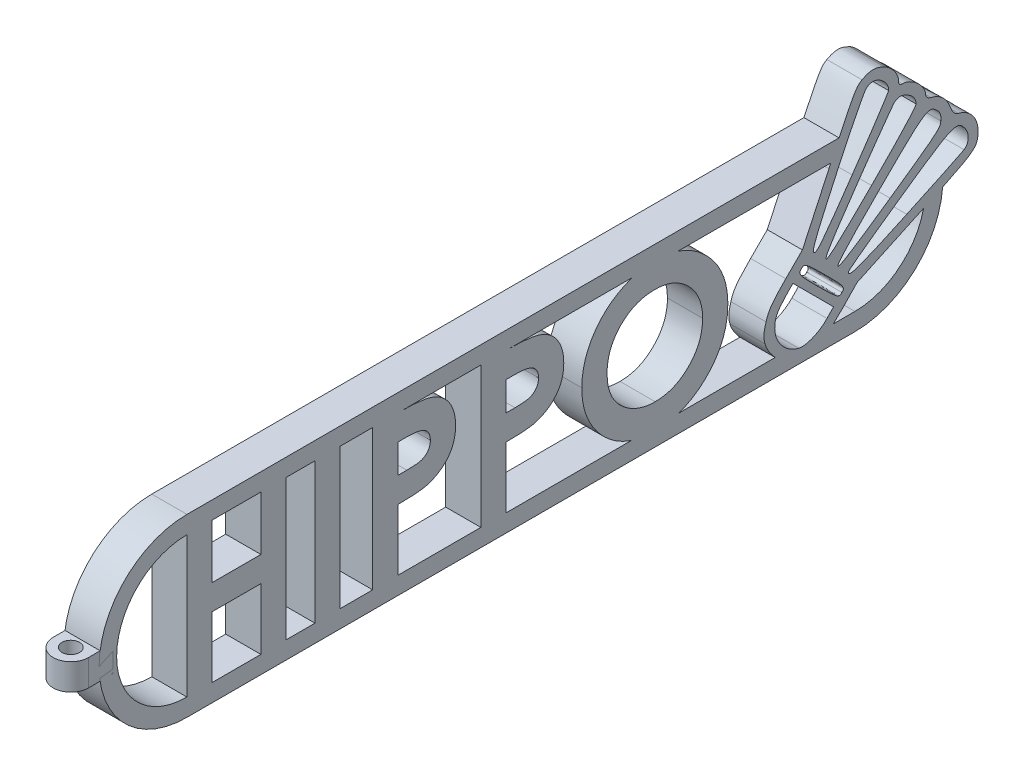
from build123d import *

# Parameters (mm, degrees)
BOSS_EXTRUDE1_DEPTH   = 3
SKETCH1_W             = 2.871794872
SKETCH1_H             = 16
BOSS_EXTRUDE1_2_DEPTH = 3
BOSS_EXTRUDE1_3_DEPTH = 3
BOSS_EXTRUDE1_4_DEPTH = 3
BOSS_EXTRUDE1_5_DEPTH = 3
BOSS_EXTRUDE2_DEPTH   = 3
BOSS_EXTRUDE4_START   = 1
SKETCH4_W             = 5.538461538
SKETCH4_H             = 6.974358974
SKETCH4_H_2           = 6.153846154
SKETCH4_W_2           = 3.282051282
SKETCH4_H_3           = 16
SKETCH4_W_3           = 3.692307692
BOSS_EXTRUDE4_DEPTH   = 1
SKETCH3_R             = 1
BOSS_EXTRUDE3_DEPTH   = 1.5


with BuildPart() as part:
    # Sketch1 → Boss-Extrude1 (new body)
    with BuildSketch(Plane(origin=(0, 0, 0), x_dir=(0, 0, -1), z_dir=(1, 0, 0))):
        Polygon((1.846153846, 16), (4.717948718, 16), (4.717948718, 9.846153846), (10.256410256, 9.846153846), (10.256410256, 16), (13.128205128, 16), (13.128205128, 0), (10.256410256, 0), (10.256410256, 6.974358974), (4.717948718, 6.974358974), (4.717948718, 0), (1.846153846, 0), align=None)
    extrude(amount=BOSS_EXTRUDE1_DEPTH)



with BuildPart() as body_2:
    # Sketch1 → Boss-Extrude1 2 (new body)
    with BuildSketch(Plane(origin=(0, 0, 0), x_dir=(0, 0, -1), z_dir=(1, 0, 0))):
        with Locations((17.846153846, 8)):
            Rectangle(SKETCH1_W, SKETCH1_H)
    extrude(amount=BOSS_EXTRUDE1_2_DEPTH)


with BuildPart() as body_3:
    # Sketch1 → Boss-Extrude1 3 (new body)
    with BuildSketch(Plane(origin=(0, 0, 0), x_dir=(0, 0, -1), z_dir=(1, 0, 0))):
        with BuildLine():
            Line((22.974358974, 16), (26.179487179, 16))
            add(Edge.make_bspline(
                [(26.179487179, 16), (26.388906098, 15.999062596), (26.79291909, 15.997254148), (27.375539064, 15.975324309), (27.913034516, 15.936024701), (28.405281958, 15.887456601), (28.85207899, 15.819366014), (29.253985136, 15.741305488), (29.611083801, 15.646205047), (29.927401804, 15.533322142), (30.211286994, 15.400237608), (30.479933945, 15.25849308), (30.727271206, 15.089325984), (30.965782637, 14.910968432), (31.181832127, 14.706381996), (31.388898137, 14.4891822), (31.578210856, 14.250755079), (31.75064749, 13.993986728), (31.907074088, 13.723621129), (32.043738828, 13.439174949), (32.154593612, 13.14019808), (32.247586992, 12.828624565), (32.32228018, 12.50446798), (32.371998344, 12.165734736), (32.405769422, 11.814789995), (32.408749254, 11.575936784), (32.41025641, 11.455128205)],
                knots=[0, 0, 0, 0, 1.698747864, 3.27724071, 4.728299578, 6.070144658, 7.288476769, 8.393259625, 9.389771311, 10.283485332, 11.113357557, 11.931608583, 12.74405601, 13.541433047, 14.344816069, 15.154114104, 15.974336324, 16.810834471, 17.661136416, 18.50621059, 19.367396281, 20.244825668, 21.142564693, 22.063065223, 23.020325768, 24, 24, 24, 24], degree=3))
            add(Edge.make_bspline(
                [(32.41025641, 11.455128205), (32.408075743, 11.321480551), (32.403790465, 11.058846488), (32.361780928, 10.673857173), (32.290015365, 10.306804718), (32.196221528, 9.954593703), (32.065432693, 9.62301878), (31.916012591, 9.304168471), (31.732178471, 9.006982358), (31.522118599, 8.727743002), (31.292709255, 8.464180055), (31.03850427, 8.223903399), (30.764348901, 8.005275075), (30.471830135, 7.806003843), (30.159849768, 7.626491675), (29.82863291, 7.465057633), (29.475917825, 7.326864876), (29.230297651, 7.254591184), (29.105769231, 7.217948718)],
                knots=[0, 0, 0, 0, 1.102006807, 2.165578795, 3.188629044, 4.184801286, 5.166646146, 6.124351954, 7.085497154, 8.042432466, 9.003981491, 9.963833307, 10.922997304, 11.89326795, 12.880200226, 13.889073926, 14.929769137, 16, 16, 16, 16], degree=3))
            add(Edge.make_bspline(
                [(29.105769231, 7.217948718), (29.023747649, 7.197541616), (28.846062492, 7.153333261), (28.55204236, 7.108450685), (28.213215028, 7.067183916), (27.828484847, 7.031720124), (27.39763001, 7.007613008), (26.921067696, 6.988786424), (26.398581937, 6.975097552), (26.035266001, 6.974611811), (25.846153846, 6.974358974)],
                knots=[0, 0, 0, 0, 0.618981996, 1.340914327, 2.176866532, 3.120127938, 4.170906482, 5.338178032, 6.614476169, 8, 8, 8, 8], degree=3))
            Line((25.846153846, 6.974358974), (25.846153846, 0))
            Line((25.846153846, 0), (22.974358974, 0))
            Line((22.974358974, 0), (22.974358974, 16))
        make_face()
        with BuildLine():
            Line((25.846153846, 9.846153846), (26.862179487, 9.846153846))
            add(Edge.make_bspline(
                [(26.862179487, 9.846153846), (27.047061393, 9.847326141), (27.387246847, 9.849483181), (27.851820047, 9.88067523), (28.225160006, 9.928311791), (28.520105507, 9.996633635), (28.752992916, 10.10032108), (28.953843726, 10.220267929), (29.126118594, 10.371937426), (29.275283272, 10.545245778), (29.394535938, 10.744385761), (29.47723145, 10.966114767), (29.530948829, 11.205774031), (29.535910128, 11.372561017), (29.538461538, 11.458333333)],
                knots=[0, 0, 0, 0, 1.8619151, 3.425951444, 4.686033666, 5.651700536, 6.461346321, 7.243864085, 7.999046032, 8.762387399, 9.539336099, 10.322741239, 11.137448474, 12, 12, 12, 12], degree=3))
            add(Edge.make_bspline(
                [(29.538461538, 11.458333333), (29.535936373, 11.533271489), (29.531036944, 11.678669529), (29.495044404, 11.888514965), (29.437682649, 12.0841342), (29.354567672, 12.263484251), (29.247119687, 12.426260373), (29.116118849, 12.572398443), (28.963246157, 12.705028132), (28.845219501, 12.775231052), (28.78525641, 12.810897436)],
                knots=[0, 0, 0, 0, 1.102301479, 2.1387299, 3.123554645, 4.094223062, 5.036071848, 5.982632524, 6.975082478, 8, 8, 8, 8], degree=3))
            add(Edge.make_bspline(
                [(28.78525641, 12.810897436), (28.734464211, 12.836584507), (28.626926718, 12.890969301), (28.443779941, 12.954195601), (28.232431357, 13.007533949), (27.991454125, 13.051804264), (27.721809572, 13.086162625), (27.423545808, 13.112438177), (27.096223909, 13.123004599), (26.868591113, 13.126423805), (26.75, 13.128205128)],
                knots=[0, 0, 0, 0, 0.656809284, 1.390599849, 2.23162475, 3.173112763, 4.218524733, 5.370385145, 6.63003504, 8, 8, 8, 8], degree=3))
            Line((26.75, 13.128205128), (25.846153846, 13.128205128))
            Line((25.846153846, 13.128205128), (25.846153846, 9.846153846))
        make_face(mode=Mode.SUBTRACT)
    extrude(amount=BOSS_EXTRUDE1_3_DEPTH)


with BuildPart() as body_4:
    # Sketch1 → Boss-Extrude1 4 (new body)
    with BuildSketch(Plane(origin=(0, 0, 0), x_dir=(0, 0, -1), z_dir=(1, 0, 0))):
        with BuildLine():
            Line((35.282051282, 16), (38.487179487, 16))
            add(Edge.make_bspline(
                [(38.487179487, 16), (38.696598406, 15.999062596), (39.100611398, 15.997254148), (39.683231371, 15.975324309), (40.220726823, 15.936024701), (40.712974265, 15.887456601), (41.159771298, 15.819366014), (41.561677444, 15.741305488), (41.918776109, 15.646205047), (42.235094112, 15.533322142), (42.518979301, 15.400237608), (42.787626252, 15.25849308), (43.034963514, 15.089325984), (43.273474945, 14.910968432), (43.489524435, 14.706381996), (43.696590444, 14.4891822), (43.885903164, 14.250755079), (44.058339798, 13.993986728), (44.214766396, 13.723621129), (44.351431136, 13.439174949), (44.46228592, 13.14019808), (44.555279299, 12.828624565), (44.629972488, 12.50446798), (44.679690652, 12.165734736), (44.71346173, 11.814789995), (44.716441561, 11.575936784), (44.717948718, 11.455128205)],
                knots=[0, 0, 0, 0, 1.698747864, 3.27724071, 4.728299578, 6.070144658, 7.288476769, 8.393259625, 9.389771311, 10.283485332, 11.113357557, 11.931608583, 12.74405601, 13.541433047, 14.344816069, 15.154114104, 15.974336324, 16.810834471, 17.661136416, 18.50621059, 19.367396281, 20.244825668, 21.142564693, 22.063065223, 23.020325768, 24, 24, 24, 24], degree=3))
            add(Edge.make_bspline(
                [(44.717948718, 11.455128205), (44.715768051, 11.321480551), (44.711482773, 11.058846488), (44.669473235, 10.673857173), (44.597707673, 10.306804718), (44.503913836, 9.954593703), (44.373125001, 9.62301878), (44.223704899, 9.304168471), (44.039870778, 9.006982358), (43.829810907, 8.727743002), (43.600401563, 8.464180055), (43.346196578, 8.223903399), (43.072041209, 8.005275075), (42.779522443, 7.806003843), (42.467542076, 7.626491675), (42.136325218, 7.465057633), (41.783610133, 7.326864876), (41.537989959, 7.254591184), (41.413461538, 7.217948718)],
                knots=[0, 0, 0, 0, 1.102006807, 2.165578795, 3.188629044, 4.184801286, 5.166646146, 6.124351954, 7.085497154, 8.042432466, 9.003981491, 9.963833307, 10.922997304, 11.89326795, 12.880200226, 13.889073926, 14.929769137, 16, 16, 16, 16], degree=3))
            add(Edge.make_bspline(
                [(41.413461538, 7.217948718), (41.331439957, 7.197541616), (41.1537548, 7.153333261), (40.859734668, 7.108450685), (40.520907336, 7.067183916), (40.136177155, 7.031720124), (39.705322317, 7.007613008), (39.228760004, 6.988786424), (38.706274245, 6.975097552), (38.342958309, 6.974611811), (38.153846154, 6.974358974)],
                knots=[0, 0, 0, 0, 0.618981996, 1.340914327, 2.176866532, 3.120127938, 4.170906482, 5.338178032, 6.614476169, 8, 8, 8, 8], degree=3))
            Line((38.153846154, 6.974358974), (38.153846154, 0))
            Line((38.153846154, 0), (35.282051282, 0))
            Line((35.282051282, 0), (35.282051282, 16))
        make_face()
        with BuildLine():
            Line((38.153846154, 9.846153846), (39.169871795, 9.846153846))
            add(Edge.make_bspline(
                [(39.169871795, 9.846153846), (39.354753701, 9.847326141), (39.694939155, 9.849483181), (40.159512354, 9.88067523), (40.532852314, 9.928311791), (40.827797815, 9.996633635), (41.060685224, 10.10032108), (41.261536034, 10.220267929), (41.433810901, 10.371937426), (41.58297558, 10.545245778), (41.702228246, 10.744385761), (41.784923758, 10.966114767), (41.838641137, 11.205774031), (41.843602435, 11.372561017), (41.846153846, 11.458333333)],
                knots=[0, 0, 0, 0, 1.8619151, 3.425951444, 4.686033666, 5.651700536, 6.461346321, 7.243864085, 7.999046032, 8.762387399, 9.539336099, 10.322741239, 11.137448474, 12, 12, 12, 12], degree=3))
            add(Edge.make_bspline(
                [(41.846153846, 11.458333333), (41.84362868, 11.533271489), (41.838729251, 11.678669529), (41.802736712, 11.888514965), (41.745374957, 12.0841342), (41.66225998, 12.263484251), (41.554811994, 12.426260373), (41.423811157, 12.572398443), (41.270938465, 12.705028132), (41.152911808, 12.775231052), (41.092948718, 12.810897436)],
                knots=[0, 0, 0, 0, 1.102301479, 2.1387299, 3.123554645, 4.094223062, 5.036071848, 5.982632524, 6.975082478, 8, 8, 8, 8], degree=3))
            add(Edge.make_bspline(
                [(41.092948718, 12.810897436), (41.042156519, 12.836584507), (40.934619026, 12.890969301), (40.751472249, 12.954195601), (40.540123665, 13.007533949), (40.299146433, 13.051804264), (40.02950188, 13.086162625), (39.731238116, 13.112438177), (39.403916217, 13.123004599), (39.176283421, 13.126423805), (39.057692308, 13.128205128)],
                knots=[0, 0, 0, 0, 0.656809284, 1.390599849, 2.23162475, 3.173112763, 4.218524733, 5.370385145, 6.63003504, 8, 8, 8, 8], degree=3))
            Line((39.057692308, 13.128205128), (38.153846154, 13.128205128))
            Line((38.153846154, 13.128205128), (38.153846154, 9.846153846))
        make_face(mode=Mode.SUBTRACT)
    extrude(amount=BOSS_EXTRUDE1_4_DEPTH)


with BuildPart() as body_5:
    # Sketch1 → Boss-Extrude1 5 (new body)
    with BuildSketch(Plane(origin=(0, 0, 0), x_dir=(0, 0, -1), z_dir=(1, 0, 0))):
        with BuildLine():
            add(Edge.make_bspline(
                [(55.108974359, 16.41025641), (55.387153968, 16.403053842), (55.936343523, 16.388834341), (56.744003176, 16.270303702), (57.522332587, 16.077175019), (58.270979798, 15.80871218), (58.988070283, 15.457643848), (59.67613346, 15.03392304), (60.332704719, 14.52955228), (60.951056044, 13.956297705), (61.52252419, 13.332908387), (62.017701673, 12.661718955), (62.439970864, 11.960120603), (62.789948699, 11.226233378), (63.056521962, 10.454974759), (63.243587447, 9.650277148), (63.363767753, 8.812369473), (63.377590338, 8.241868554), (63.384615385, 7.951923077)],
                knots=[0, 0, 0, 0, 1.014329547, 2.002516266, 2.970391464, 3.935626869, 4.897733899, 5.877609409, 6.878433252, 7.912639331, 8.949961323, 9.958554974, 10.949718813, 11.932905612, 12.9188844, 13.919928257, 14.942845884, 16, 16, 16, 16], degree=3))
            add(Edge.make_bspline(
                [(63.384615385, 7.951923077), (63.377134013, 7.665244615), (63.362391732, 7.100335509), (63.248493733, 6.270149483), (63.058278042, 5.47407186), (62.796226071, 4.7103007), (62.45259551, 3.982535448), (62.038561028, 3.286129425), (61.543197042, 2.627545446), (60.984571421, 2.00713693), (60.369573092, 1.443983078), (59.718192232, 0.947704717), (59.033436515, 0.527177163), (58.316308205, 0.182593037), (57.565269455, -0.084826013), (56.782175423, -0.273509584), (55.967074566, -0.388176401), (55.412766454, -0.402822387), (55.131410256, -0.41025641)],
                knots=[0, 0, 0, 0, 1.051557043, 2.072126891, 3.067553643, 4.050577992, 5.02905126, 6.015227836, 7.017913613, 8.04756643, 9.074058332, 10.072836633, 11.047628519, 12.017157415, 12.98668631, 13.966869689, 14.968021931, 16, 16, 16, 16], degree=3))
            add(Edge.make_bspline(
                [(55.131410256, -0.41025641), (54.837145409, -0.403587725), (54.258955208, -0.390484671), (53.412771259, -0.265880606), (52.60205392, -0.078183356), (51.833613682, 0.201944721), (51.099624639, 0.552128372), (50.405479625, 0.983400533), (49.751411916, 1.495048493), (49.141173354, 2.073968758), (48.588295738, 2.707434505), (48.100272795, 3.376634891), (47.688614616, 4.076457815), (47.353306141, 4.807230807), (47.088962408, 5.564412293), (46.90249794, 6.352613725), (46.792348928, 7.16994471), (46.777005811, 7.725092254), (46.769230769, 8.006410256)],
                knots=[0, 0, 0, 0, 1.067978421, 2.098431617, 3.099715153, 4.085208694, 5.062210972, 6.048429807, 7.046490867, 8.072918869, 9.098532598, 10.095778865, 11.076610158, 12.041847152, 13.011192615, 13.984257998, 14.978533688, 16, 16, 16, 16], degree=3))
            add(Edge.make_bspline(
                [(46.769230769, 8.006410256), (46.771671025, 8.195666282), (46.776520638, 8.571781917), (46.834939331, 9.129166089), (46.919045453, 9.67567087), (47.043434416, 10.209117338), (47.194535214, 10.73326871), (47.390307643, 11.243246055), (47.613149647, 11.744497333), (47.873519548, 12.231102139), (48.163025702, 12.698583302), (48.478902692, 13.144735632), (48.821944785, 13.564164496), (49.191046931, 13.959626206), (49.587481104, 14.328521364), (50.006032622, 14.676072195), (50.454818949, 14.993046513), (50.924017559, 15.287185464), (51.410983218, 15.553170215), (51.913733536, 15.779568481), (52.421910861, 15.97727823), (52.942303757, 16.133319506), (53.46933529, 16.260413493), (54.008635723, 16.344462927), (54.555332783, 16.402880002), (54.9239892, 16.407791772), (55.108974359, 16.41025641)],
                knots=[0, 0, 0, 0, 1.034744296, 2.056386356, 3.06226378, 4.057406941, 5.050368692, 6.043467995, 7.042652155, 8.049140477, 9.059438543, 10.048523776, 11.036952808, 12.020949711, 13.004946614, 13.997082645, 14.994316842, 16.007702937, 17.024872941, 18.026463647, 19.021641123, 20.005082605, 20.995858141, 21.984425357, 22.988620895, 24, 24, 24, 24], degree=3))
        make_face()
        with BuildLine():
            add(Edge.make_bspline(
                [(55.064102564, 13.538461538), (54.876887724, 13.533438144), (54.507400546, 13.523523973), (53.965430146, 13.447991403), (53.445119422, 13.327357302), (52.949352663, 13.152620282), (52.475981172, 12.930224403), (52.024165807, 12.660946744), (51.600163279, 12.335531187), (51.198319922, 11.971447842), (50.835320574, 11.565775324), (50.514599198, 11.131028229), (50.246207064, 10.667932578), (50.021426971, 10.180790419), (49.852217379, 9.664123968), (49.73169446, 9.12198033), (49.655528474, 8.553425364), (49.645927657, 8.165842183), (49.641025641, 7.967948718)],
                knots=[0, 0, 0, 0, 1.033739768, 2.040188636, 3.016340934, 3.979330865, 4.937572243, 5.900995986, 6.878200029, 7.884839167, 8.891893314, 9.879764717, 10.863503415, 11.843163062, 12.837761627, 13.859916423, 14.907309254, 16, 16, 16, 16], degree=3))
            add(Edge.make_bspline(
                [(49.641025641, 7.967948718), (49.647524966, 7.748638243), (49.660262566, 7.31882605), (49.749885868, 6.691827604), (49.903222417, 6.099689801), (50.124637412, 5.545308699), (50.399250095, 5.02252831), (50.740275463, 4.537756052), (51.14219052, 4.088089335), (51.451822624, 3.825555176), (51.608974359, 3.692307692)],
                knots=[0, 0, 0, 0, 1.078454662, 2.113592447, 3.107694534, 4.079536787, 5.043276885, 6.005368276, 6.987637804, 8, 8, 8, 8], degree=3))
            add(Edge.make_bspline(
                [(51.608974359, 3.692307692), (51.737711632, 3.593869569), (51.992285706, 3.39921115), (52.398641353, 3.149716454), (52.817107655, 2.93587461), (53.250842463, 2.76309293), (53.698929753, 2.627185764), (54.161308078, 2.532012211), (54.637322287, 2.472282576), (54.959225404, 2.465143753), (55.121794872, 2.461538462)],
                knots=[0, 0, 0, 0, 1.023928204, 2.024787132, 3.009472467, 3.9914905, 4.972207045, 5.96565515, 6.972602802, 8, 8, 8, 8], degree=3))
            add(Edge.make_bspline(
                [(55.121794872, 2.461538462), (55.305790548, 2.466604449), (55.667807828, 2.476571938), (56.199689156, 2.551174661), (56.709247624, 2.677429404), (57.199646612, 2.85063357), (57.669472029, 3.075821821), (58.116427711, 3.353451628), (58.541297292, 3.680114055), (58.942628705, 4.048978611), (59.309464588, 4.456249199), (59.629516685, 4.89331519), (59.906442347, 5.350546712), (60.126548135, 5.834415186), (60.302442816, 6.340353118), (60.421515178, 6.870601199), (60.498324594, 7.422973545), (60.507928117, 7.798882447), (60.512820513, 7.990384615)],
                knots=[0, 0, 0, 0, 1.026359118, 2.019393844, 2.989460624, 3.950973911, 4.916101784, 5.890408035, 6.881132271, 7.902007068, 8.92769091, 9.933912415, 10.920395702, 11.90457117, 12.894218921, 13.903490204, 14.931958862, 16, 16, 16, 16], degree=3))
            add(Edge.make_bspline(
                [(60.512820513, 7.990384615), (60.507758839, 8.180785593), (60.497795706, 8.55556088), (60.423061677, 9.106513081), (60.297607609, 9.634420272), (60.12388333, 10.140144582), (59.902046624, 10.624181809), (59.627723033, 11.084829791), (59.301875124, 11.521643194), (58.932002266, 11.931645303), (58.529418393, 12.308410978), (58.097204379, 12.635375095), (57.647454059, 12.919496516), (57.169847964, 13.142065766), (56.674157517, 13.319386214), (56.157357987, 13.449967537), (55.617491964, 13.522993353), (55.250209947, 13.533259517), (55.064102564, 13.538461538)],
                knots=[0, 0, 0, 0, 1.055025985, 2.07665775, 3.074803781, 4.057872707, 5.035505728, 6.020516407, 7.023567878, 8.050795229, 9.077271434, 10.074415901, 11.050397877, 12.019801805, 12.988065821, 13.964604439, 14.968634123, 16, 16, 16, 16], degree=3))
        make_face(mode=Mode.SUBTRACT)
    extrude(amount=BOSS_EXTRUDE1_5_DEPTH)


with BuildPart() as part_1:
    add(part.part)

    add(body_2.part)  # Boss-Extrude2 merges body 2

    add(body_3.part)  # Boss-Extrude2 merges body 3

    add(body_4.part)  # Boss-Extrude2 merges body 4

    add(body_5.part)  # Boss-Extrude2 merges body 5
    # Sketch2 → Boss-Extrude2 (add)
    with BuildSketch(Plane(origin=(3, 0, 0), x_dir=(0, 0, -1), z_dir=(1, 0, 0))):
        with BuildLine():
            Line((1.846153846, -2), (77.846153846, -2))
            ThreePointArc((77.846153846, -2), (84.649917696, 0.671371378), (87.818605543, 7.258240505))
            add(Edge.make_bspline(
                [(87.818605543, 7.258240505), (91.800935344, 9.142841318), (91.845602736, 9.438617811), (91.845602736, 12.150490205), (90.92059822, 13.317757808), (89.621187114, 13.626092647)],
                knots=[0.177781227, 0.177781227, 0.177781227, 0.177781227, 1, 1, 1.756410256, 1.756410256, 1.756410256, 1.756410256], degree=3))
            add(Edge.make_bspline(
                [(89.621187114, 13.626092647), (89.20273269, 13.736212232), (88.938445685, 14.022523154), (88.674158681, 14.771336334)],
                knots=[0, 0, 0, 0, 1, 1, 1, 1], degree=3))
            add(Edge.make_bspline(
                [(88.674158681, 14.771336334), (88.277728174, 15.806460435), (87.506891077, 16.511225781), (86.493790893, 16.753488868)],
                knots=[0, 0, 0, 0, 1, 1, 1, 1], degree=3))
            add(Edge.make_bspline(
                [(86.493790893, 16.753488868), (86.14140822, 16.841584536), (85.899145132, 17.061823707), (85.899145132, 18.295163061), (84.357470939, 19.72671767), (82.947940248, 19.72671767), (82.815796745, 19.858861172), (82.815796745, 20.938033107), (82.089007483, 21.951133292), (81.230074718, 22.391611633)],
                knots=[0, 0, 0, 0, 1, 1, 5.6, 5.6, 6.888, 6.888, 9.807466667, 9.807466667, 9.807466667, 9.807466667], degree=3))
            add(Edge.make_bspline(
                [(81.230074718, 22.391611633), (80.216974534, 22.920185642), (79.622328773, 22.920185642), (78.653276423, 22.41363555)],
                knots=[0, 0, 0, 0, 1, 1, 1, 1], degree=3))
            add(Edge.make_bspline(
                [(78.653276423, 22.41363555), (78.080225755, 22.136352968), (77.755424413, 21.641852226), (76.037997737, 18)],
                knots=[0, 0, 0, 0, 0.83933777, 0.83933777, 0.83933777, 0.83933777], degree=3))
            Line((76.037997737, 18), (1.846153846, 18))
            ThreePointArc((1.846153846, 18), (-8.153846154, 8), (1.846153846, -2))
        make_face()
        with BuildLine():
            ThreePointArc((1.846153846, 0), (-6.153846154, 8), (1.846153846, 16))
            Line((1.846153846, 16), (75.100801984, 16))
            add(Edge.make_bspline(
                [(75.100801984, 16), (75.031260643, 15.851019379), (74.960072683, 15.698441176), (74.887186608, 15.54217343)],
                knots=[0.973524755, 0.973524755, 0.973524755, 0.973524755, 1, 1, 1, 1], degree=3))
            Line((74.887186608, 15.54217343), (71.869909972, 9.045117901))
            Line((71.869909972, 9.045117901), (69.975853106, 7.151061035))
            add(Edge.make_bspline(
                [(69.975853106, 7.151061035), (68.368107161, 5.521291173), (68.037748406, 5.058788915), (67.729413567, 4.023664814)],
                knots=[0, 0, 0, 0, 1, 1, 1, 1], degree=3))
            add(Edge.make_bspline(
                [(67.729413567, 4.023664814), (67.443102645, 3.032588547), (67.421078728, 2.614134123), (67.619293982, 1.88734486)],
                knots=[0, 0, 0, 0, 1, 1, 1, 1], degree=3))
            add(Edge.make_bspline(
                [(67.619293982, 1.88734486), (67.775455556, 1.298735849), (68.213348721, 0.605296478), (68.765015275, 0)],
                knots=[0, 0, 0, 0, 0.545426537, 0.545426537, 0.545426537, 0.545426537], degree=3))
            Line((68.765015275, 0), (1.846153846, 0))
        make_face(mode=Mode.SUBTRACT)
        with BuildLine():
            add(Edge.make_bspline(
                [(71.429431631, -0.42516643), (69.931805272, -0.072783757), (68.720489834, 1.424842602), (68.720489834, 3.869497394), (68.984776839, 4.398071404), (69.997877023, 5.477243339)],
                knots=[0, 0, 0, 0, 1, 1, 1.681818182, 1.681818182, 1.681818182, 1.681818182], degree=3))
            Line((69.997877023, 5.477243339), (70.790738037, 6.29212827))
            Line((70.790738037, 6.29212827), (75.415760617, 1.667105689))
            Line((75.415760617, 1.667105689), (74.666947437, 0.896268593))
            add(Edge.make_bspline(
                [(74.666947437, 0.896268593), (73.763966838, -0.05075984), (72.288364396, -0.645405601), (71.429431631, -0.42516643)],
                knots=[0, 0, 0, 0, 1, 1, 1, 1], degree=3))
        make_face(mode=Mode.SUBTRACT)
        with BuildLine():
            Line((77.846153846, 0), (75.381562258, 0))
            add(Edge.make_bspline(
                [(75.381562258, 0), (75.711246048, 0.288938545), (76.052198251, 0.616829678), (76.406836884, 0.984364261)],
                knots=[0.853614252, 0.853614252, 0.853614252, 0.853614252, 1, 1, 1, 1], degree=3))
            Line((76.406836884, 0.984364261), (78.08065458, 2.724253708))
            Line((78.08065458, 2.724253708), (84.643781861, 5.785578178))
            add(Edge.make_bspline(
                [(84.643781861, 5.785578178), (84.997019467, 5.948023867), (85.332932829, 6.102589993), (85.652371524, 6.249866987)],
                knots=[0, 0, 0, 0, 0.049502526, 0.049502526, 0.049502526, 0.049502526], degree=3))
            ThreePointArc((85.652371524, 6.249866987), (82.846100641, 1.754959404), (77.846153846, 0))
        make_face(mode=Mode.SUBTRACT)
        with BuildLine():
            add(Edge.make_bspline(
                [(83.740801262, 6.622487025), (78.30089375, 4.089736565), (76.891363059, 3.60521039), (77.133626147, 4.309975735)],
                knots=[0, 0, 0, 0, 1, 1, 1, 1], degree=3))
            add(Edge.make_bspline(
                [(77.133626147, 4.309975735), (77.177673981, 4.442119238), (79.732448359, 6.314152187), (82.815796745, 8.472496058)],
                knots=[0, 0, 0, 0, 1, 1, 1, 1], degree=3))
            add(Edge.make_bspline(
                [(82.815796745, 8.472496058), (88.938445685, 12.767159882), (89.42297186, 12.987399053), (90.281904625, 11.8862032)],
                knots=[0, 0, 0, 0, 1, 1, 1, 1], degree=3))
            add(Edge.make_bspline(
                [(90.281904625, 11.8862032), (90.898574302, 11.093342186), (90.876550385, 10.146313753), (90.259880708, 9.727859329)],
                knots=[0, 0, 0, 0, 1, 1, 1, 1], degree=3))
            add(Edge.make_bspline(
                [(90.259880708, 9.727859329), (89.973569786, 9.551667993), (87.044388819, 8.142137302), (83.740801262, 6.622487025)],
                knots=[0, 0, 0, 0, 1, 1, 1, 1], degree=3))
        make_face(mode=Mode.SUBTRACT)
        with BuildLine():
            add(Edge.make_bspline(
                [(79.137802598, 21.334463614), (79.732448359, 21.841013706), (80.547333289, 21.66482237), (81.230074718, 20.893985273)],
                knots=[0, 0, 0, 0, 1, 1, 1, 1], degree=3))
            add(Edge.make_bspline(
                [(81.230074718, 20.893985273), (81.538409557, 20.5416026), (81.714600893, 20.123148177), (81.670553059, 19.858861172)],
                knots=[0, 0, 0, 0, 1, 1, 1, 1], degree=3))
            add(Edge.make_bspline(
                [(81.670553059, 19.858861172), (81.604481308, 19.594574167), (79.754472276, 16.797536702), (77.530056654, 13.60406873)],
                knots=[0, 0, 0, 0, 1, 1, 1, 1], degree=3))
            add(Edge.make_bspline(
                [(77.530056654, 13.60406873), (74.072301677, 8.626663477), (73.455632, 7.85582638), (72.92705799, 8.384400389), (73.279440663, 9.309404905), (75.76814329, 14.683240665)],
                knots=[0, 0, 0, 0, 1, 1, 2, 2, 2, 2], degree=3))
            add(Edge.make_bspline(
                [(75.76814329, 14.683240665), (77.353865317, 18.118971725), (78.873515594, 21.114224444), (79.137802598, 21.334463614)],
                knots=[0, 0, 0, 0, 1, 1, 1, 1], degree=3))
        make_face(mode=Mode.SUBTRACT)
        with BuildLine():
            add(Edge.make_bspline(
                [(87.617010662, 13.890379652), (87.550938911, 13.185614306), (87.220580155, 12.921327302), (81.846744395, 9.155237486)],
                knots=[0, 0, 0, 0, 1, 1, 1, 1], degree=3))
            add(Edge.make_bspline(
                [(81.846744395, 9.155237486), (77.794343658, 6.314152187), (76.076478128, 5.234980251), (75.900286792, 5.411171588)],
                knots=[0, 0, 0, 0, 1, 1, 1, 1], degree=3))
            add(Edge.make_bspline(
                [(75.900286792, 5.411171588), (75.746119373, 5.565339007), (77.089578313, 7.062965366), (85.921169049, 15.894556103), (86.229503888, 16.092771357), (87.242604072, 15.079671172)],
                knots=[0, 0, 0, 0, 1, 1, 2.50625, 2.50625, 2.50625, 2.50625], degree=3))
            add(Edge.make_bspline(
                [(87.242604072, 15.079671172), (87.550938911, 14.771336334), (87.661058496, 14.418953661), (87.617010662, 13.890379652)],
                knots=[0, 0, 0, 0, 1, 1, 1, 1], degree=3))
        make_face(mode=Mode.SUBTRACT)
        with BuildLine():
            add(Edge.make_bspline(
                [(84.79794928, 16.973728039), (84.79794928, 16.687417117), (83.036035916, 14.771336334), (79.732448359, 11.467748776)],
                knots=[0, 0, 0, 0, 1, 1, 1, 1], degree=3))
            add(Edge.make_bspline(
                [(79.732448359, 11.467748776), (78.201685577, 9.94215749), (77.018222039, 8.783294776), (76.170937251, 8)],
                knots=[0, 0, 0, 0, 0.234812721, 0.234812721, 0.234812721, 0.234812721], degree=3))
            add(Edge.make_bspline(
                [(76.170937251, 8), (73.40987925, 5.447467085), (74.218774266, 6.883169267), (78.212798082, 12.612992463)],
                knots=[0.234812721, 0.234812721, 0.234812721, 0.234812721, 1, 1, 1, 1], degree=3))
            add(Edge.make_bspline(
                [(78.212798082, 12.612992463), (80.305070202, 15.608245182), (82.155079234, 18.207067393), (82.353294487, 18.361234813)],
                knots=[0, 0, 0, 0, 1, 1, 1, 1], degree=3))
            add(Edge.make_bspline(
                [(82.353294487, 18.361234813), (82.771748911, 18.691593568), (83.146155501, 18.691593568), (83.762825179, 18.361234813)],
                knots=[0, 0, 0, 0, 1, 1, 1, 1], degree=3))
            add(Edge.make_bspline(
                [(83.762825179, 18.361234813), (84.401518773, 18.030876057), (84.775925363, 17.524325965), (84.79794928, 16.973728039)],
                knots=[0, 0, 0, 0, 1, 1, 1, 1], degree=3))
        make_face(mode=Mode.SUBTRACT)
        with BuildLine():
            add(Edge.make_bspline(
                [(76.36278905, 2.614134123), (76.010406377, 2.239727533), (75.878262875, 2.349847118), (73.67587117, 4.530214906)],
                knots=[0, 0, 0, 0, 1, 1, 1, 1], degree=3))
            add(Edge.make_bspline(
                [(73.67587117, 4.530214906), (71.495503382, 6.710582694), (71.385383797, 6.842726196), (71.73776647, 7.239156703)],
                knots=[0, 0, 0, 0, 1, 1, 1, 1], degree=3))
            add(Edge.make_bspline(
                [(71.73776647, 7.239156703), (72.090149143, 7.613563293), (72.200268728, 7.525467625), (74.42468435, 5.32307592)],
                knots=[0, 0, 0, 0, 1, 1, 1, 1], degree=3))
            add(Edge.make_bspline(
                [(74.42468435, 5.32307592), (76.627076055, 3.120684215), (76.73719564, 2.966516795), (76.36278905, 2.614134123)],
                knots=[0, 0, 0, 0, 1, 1, 1, 1], degree=3))
        make_face(mode=Mode.SUBTRACT)
    extrude(amount=-BOSS_EXTRUDE2_DEPTH)

    # Sketch4 → Boss-Extrude4 (add)
    with BuildSketch(Plane(origin=(3, 0, 0), x_dir=(0, 0, -1), z_dir=(1, 0, 0)).offset(BOSS_EXTRUDE4_START)):
        with BuildLine():
            Line((1.846153846, -2), (77.846153846, -2))
            ThreePointArc((77.846153846, -2), (84.649917696, 0.671371378), (87.818605543, 7.258240505))
            add(Edge.make_bspline(
                [(87.818605543, 7.258240505), (91.800935344, 9.142841318), (91.845602736, 9.438617811), (91.845602736, 10.851079099)],
                knots=[0.177781227, 0.177781227, 0.177781227, 0.177781227, 1, 1, 1, 1], degree=3))
            add(Edge.make_bspline(
                [(91.845602736, 10.851079099), (91.845602736, 12.150490205), (90.92059822, 13.317757808), (89.621187114, 13.626092647)],
                knots=[0, 0, 0, 0, 1, 1, 1, 1], degree=3))
            add(Edge.make_bspline(
                [(89.621187114, 13.626092647), (89.20273269, 13.736212232), (88.938445685, 14.022523154), (88.674158681, 14.771336334)],
                knots=[0, 0, 0, 0, 1, 1, 1, 1], degree=3))
            add(Edge.make_bspline(
                [(88.674158681, 14.771336334), (88.277728174, 15.806460435), (87.506891077, 16.511225781), (86.493790893, 16.753488868)],
                knots=[0, 0, 0, 0, 1, 1, 1, 1], degree=3))
            add(Edge.make_bspline(
                [(86.493790893, 16.753488868), (86.14140822, 16.841584536), (85.899145132, 17.061823707), (85.899145132, 17.282062877)],
                knots=[0, 0, 0, 0, 1, 1, 1, 1], degree=3))
            add(Edge.make_bspline(
                [(85.899145132, 17.282062877), (85.899145132, 18.295163061), (84.357470939, 19.72671767), (83.256275086, 19.72671767)],
                knots=[0, 0, 0, 0, 1, 1, 1, 1], degree=3))
            add(Edge.make_bspline(
                [(83.256275086, 19.72671767), (82.947940248, 19.72671767), (82.815796745, 19.858861172), (82.815796745, 20.189219928)],
                knots=[0, 0, 0, 0, 1, 1, 1, 1], degree=3))
            add(Edge.make_bspline(
                [(82.815796745, 20.189219928), (82.815796745, 20.938033107), (82.089007483, 21.951133292), (81.230074718, 22.391611633)],
                knots=[0, 0, 0, 0, 1, 1, 1, 1], degree=3))
            add(Edge.make_bspline(
                [(81.230074718, 22.391611633), (80.216974534, 22.920185642), (79.622328773, 22.920185642), (78.653276423, 22.41363555)],
                knots=[0, 0, 0, 0, 1, 1, 1, 1], degree=3))
            add(Edge.make_bspline(
                [(78.653276423, 22.41363555), (78.080225755, 22.136352968), (77.755424413, 21.641852226), (76.037997736, 17.999999998)],
                knots=[0, 0, 0, 0, 0.839337771, 0.839337771, 0.839337771, 0.839337771], degree=3))
            Line((76.037997736, 17.999999998), (1.846153846, 18))
            ThreePointArc((1.846153846, 18), (-8.153846154, 8), (1.846153846, -2))
        make_face()
        with BuildLine():
            Line((1.846153846, 0), (1.846153846, 16))
            ThreePointArc((1.846153846, 16), (-6.153846154, 8), (1.846153846, 0))
        make_face(mode=Mode.SUBTRACT)
        with BuildLine():
            Line((75.381562269, 0), (77.846153846, 0))
            ThreePointArc((77.846153846, 0), (82.846100641, 1.754959404), (85.652371524, 6.249866987))
            add(Edge.make_bspline(
                [(85.652371524, 6.249866987), (85.332932829, 6.102589993), (84.997019467, 5.948023867), (84.643781861, 5.785578178)],
                knots=[0, 0, 0, 0, 0.049502526, 0.049502526, 0.049502526, 0.049502526], degree=3))
            Line((84.643781861, 5.785578178), (78.08065458, 2.724253708))
            Line((78.08065458, 2.724253708), (76.406836884, 0.984364261))
            add(Edge.make_bspline(
                [(76.406836884, 0.984364261), (76.052198254, 0.61682968), (75.711246052, 0.288938549), (75.381562269, 0)],
                knots=[0.853614253, 0.853614253, 0.853614253, 0.853614253, 1, 1, 1, 1], degree=3))
        make_face(mode=Mode.SUBTRACT)
        with BuildLine():
            Line((70.790738037, 6.29212827), (69.997877023, 5.477243339))
            add(Edge.make_bspline(
                [(69.997877023, 5.477243339), (68.984776839, 4.398071404), (68.720489834, 3.869497394), (68.720489834, 2.878421127)],
                knots=[0, 0, 0, 0, 1, 1, 1, 1], degree=3))
            add(Edge.make_bspline(
                [(68.720489834, 2.878421127), (68.720489834, 1.424842602), (69.931805272, -0.072783757), (71.429431631, -0.42516643)],
                knots=[0, 0, 0, 0, 1, 1, 1, 1], degree=3))
            add(Edge.make_bspline(
                [(71.429431631, -0.42516643), (72.288364396, -0.645405601), (73.763966838, -0.05075984), (74.666947437, 0.896268593)],
                knots=[0, 0, 0, 0, 1, 1, 1, 1], degree=3))
            Line((74.666947437, 0.896268593), (75.415760617, 1.667105689))
            Line((75.415760617, 1.667105689), (70.790738037, 6.29212827))
        make_face(mode=Mode.SUBTRACT)
        with Locations((7.487179487, 3.487179487)):
            Rectangle(SKETCH4_W, SKETCH4_H, mode=Mode.SUBTRACT)
        with Locations((7.487179487, 12.923076923)):
            Rectangle(SKETCH4_W, SKETCH4_H_2, mode=Mode.SUBTRACT)
        with Locations((14.769230769, 8)):
            Rectangle(SKETCH4_W_2, SKETCH4_H_3, mode=Mode.SUBTRACT)
        with Locations((21.128205128, 8)):
            Rectangle(SKETCH4_W_3, SKETCH4_H_3, mode=Mode.SUBTRACT)
        with BuildLine():
            Line((25.846153846, 9.846153846), (26.862179487, 9.846153846))
            add(Edge.make_bspline(
                [(26.862179487, 9.846153846), (27.047061393, 9.847326141), (27.387246847, 9.849483181), (27.851820047, 9.88067523), (28.225160006, 9.928311791), (28.520105507, 9.996633635), (28.752992916, 10.10032108), (28.953843726, 10.220267929), (29.126118594, 10.371937426), (29.275283272, 10.545245778), (29.394535938, 10.744385761), (29.47723145, 10.966114767), (29.530948829, 11.205774031), (29.535910128, 11.372561017), (29.538461538, 11.458333333)],
                knots=[0, 0, 0, 0, 0.155159592, 0.285495954, 0.390502806, 0.470975045, 0.538445527, 0.60365534, 0.666587169, 0.73019895, 0.794944675, 0.860228437, 0.928120706, 1, 1, 1, 1], degree=3))
            add(Edge.make_bspline(
                [(29.538461538, 11.458333333), (29.535936373, 11.533271489), (29.531036944, 11.678669529), (29.495044404, 11.888514965), (29.437682649, 12.0841342), (29.354567672, 12.263484251), (29.247119687, 12.426260373), (29.116118849, 12.572398443), (28.963246157, 12.705028132), (28.845219501, 12.775231052), (28.78525641, 12.810897436)],
                knots=[0, 0, 0, 0, 0.137787685, 0.267341238, 0.390444331, 0.511777883, 0.629508981, 0.747829066, 0.87188531, 1, 1, 1, 1], degree=3))
            add(Edge.make_bspline(
                [(28.78525641, 12.810897436), (28.734464211, 12.836584507), (28.626926718, 12.890969301), (28.443779941, 12.954195601), (28.232431357, 13.007533949), (27.991454125, 13.051804264), (27.721809572, 13.086162625), (27.423545808, 13.112438177), (27.096223909, 13.123004599), (26.868591113, 13.126423805), (26.75, 13.128205128)],
                knots=[0, 0, 0, 0, 0.08210116, 0.173824981, 0.278953094, 0.396639095, 0.527315592, 0.671298143, 0.82875438, 1, 1, 1, 1], degree=3))
            Line((26.75, 13.128205128), (25.846153846, 13.128205128))
            Line((25.846153846, 13.128205128), (25.846153846, 9.846153846))
        make_face(mode=Mode.SUBTRACT)
        with BuildLine():
            Line((35.282051282, 16), (26.179487179, 16))
            add(Edge.make_bspline(
                [(26.179487179, 16), (26.388906098, 15.999062596), (26.79291909, 15.997254148), (27.375539064, 15.975324309), (27.913034516, 15.936024701), (28.405281958, 15.887456601), (28.85207899, 15.819366014), (29.253985136, 15.741305488), (29.611083801, 15.646205047), (29.927401804, 15.533322142), (30.211286994, 15.400237608), (30.479933945, 15.25849308), (30.727271206, 15.089325984), (30.965782637, 14.910968432), (31.181832127, 14.706381996), (31.388898137, 14.4891822), (31.578210856, 14.250755079), (31.75064749, 13.993986728), (31.907074088, 13.723621129), (32.043738828, 13.439174949), (32.154593612, 13.14019808), (32.247586992, 12.828624565), (32.32228018, 12.50446798), (32.371998344, 12.165734736), (32.405769422, 11.814789995), (32.408749254, 11.575936784), (32.41025641, 11.455128205)],
                knots=[0, 0, 0, 0, 0.070781161, 0.136551696, 0.197012482, 0.252922694, 0.303686532, 0.349719151, 0.391240471, 0.428478555, 0.463056565, 0.497150358, 0.531002334, 0.564226377, 0.59770067, 0.631421421, 0.665597347, 0.700451436, 0.735880684, 0.771092108, 0.806974845, 0.843534403, 0.880940196, 0.919294384, 0.95918024, 1, 1, 1, 1], degree=3))
            add(Edge.make_bspline(
                [(32.41025641, 11.455128205), (32.408075743, 11.321480551), (32.403790465, 11.058846488), (32.361780928, 10.673857173), (32.290015365, 10.306804718), (32.196221528, 9.954593703), (32.065432693, 9.62301878), (31.916012591, 9.304168471), (31.732178471, 9.006982358), (31.522118599, 8.727743002), (31.292709255, 8.464180055), (31.03850427, 8.223903399), (30.764348901, 8.005275075), (30.471830135, 7.806003843), (30.159849768, 7.626491675), (29.82863291, 7.465057633), (29.475917825, 7.326864876), (29.230297651, 7.254591184), (29.105769231, 7.217948718)],
                knots=[0, 0, 0, 0, 0.068875425, 0.135348675, 0.199289315, 0.26155008, 0.322915384, 0.382771997, 0.442843572, 0.502652029, 0.562748843, 0.622739582, 0.682687332, 0.743329247, 0.805012514, 0.86806712, 0.933110571, 1, 1, 1, 1], degree=3))
            add(Edge.make_bspline(
                [(29.105769231, 7.217948718), (29.023747649, 7.197541616), (28.846062492, 7.153333261), (28.55204236, 7.108450685), (28.213215028, 7.067183916), (27.828484847, 7.031720124), (27.39763001, 7.007613008), (26.921067696, 6.988786424), (26.398581937, 6.975097552), (26.035266001, 6.974611811), (25.846153846, 6.974358974)],
                knots=[0, 0, 0, 0, 0.077372749, 0.167614291, 0.272108317, 0.390015992, 0.52136331, 0.667272254, 0.826809521, 1, 1, 1, 1], degree=3))
            Line((25.846153846, 6.974358974), (25.846153846, 0))
            Line((25.846153846, 0), (35.282051282, 0))
            Line((35.282051282, 0), (35.282051282, 16))
        make_face(mode=Mode.SUBTRACT)
        with BuildLine():
            Line((38.153846154, 9.846153846), (39.169871795, 9.846153846))
            add(Edge.make_bspline(
                [(39.169871795, 9.846153846), (39.354753701, 9.847326141), (39.694939155, 9.849483181), (40.159512354, 9.88067523), (40.532852314, 9.928311791), (40.827797815, 9.996633635), (41.060685224, 10.10032108), (41.261536034, 10.220267929), (41.433810901, 10.371937426), (41.58297558, 10.545245778), (41.702228246, 10.744385761), (41.784923758, 10.966114767), (41.838641137, 11.205774031), (41.843602435, 11.372561017), (41.846153846, 11.458333333)],
                knots=[0, 0, 0, 0, 0.155159592, 0.285495954, 0.390502806, 0.470975045, 0.538445527, 0.60365534, 0.666587169, 0.73019895, 0.794944675, 0.860228437, 0.928120706, 1, 1, 1, 1], degree=3))
            add(Edge.make_bspline(
                [(41.846153846, 11.458333333), (41.84362868, 11.533271489), (41.838729251, 11.678669529), (41.802736712, 11.888514965), (41.745374957, 12.0841342), (41.66225998, 12.263484251), (41.554811994, 12.426260373), (41.423811157, 12.572398443), (41.270938465, 12.705028132), (41.152911808, 12.775231052), (41.092948718, 12.810897436)],
                knots=[0, 0, 0, 0, 0.137787685, 0.267341238, 0.390444331, 0.511777883, 0.629508981, 0.747829066, 0.87188531, 1, 1, 1, 1], degree=3))
            add(Edge.make_bspline(
                [(41.092948718, 12.810897436), (41.042156519, 12.836584507), (40.934619026, 12.890969301), (40.751472249, 12.954195601), (40.540123665, 13.007533949), (40.299146433, 13.051804264), (40.02950188, 13.086162625), (39.731238116, 13.112438177), (39.403916217, 13.123004599), (39.176283421, 13.126423805), (39.057692308, 13.128205128)],
                knots=[0, 0, 0, 0, 0.08210116, 0.173824981, 0.278953094, 0.396639095, 0.527315592, 0.671298143, 0.82875438, 1, 1, 1, 1], degree=3))
            Line((39.057692308, 13.128205128), (38.153846154, 13.128205128))
            Line((38.153846154, 13.128205128), (38.153846154, 9.846153846))
        make_face(mode=Mode.SUBTRACT)
        with BuildLine():
            Line((57.787985537, 0), (68.765015266, 0))
            add(Edge.make_bspline(
                [(68.765015266, 0), (68.213348719, 0.605296481), (67.775455556, 1.29873585), (67.619293982, 1.88734486)],
                knots=[0, 0, 0, 0, 0.545426536, 0.545426536, 0.545426536, 0.545426536], degree=3))
            add(Edge.make_bspline(
                [(67.619293982, 1.88734486), (67.421078728, 2.614134123), (67.443102645, 3.032588547), (67.729413567, 4.023664814)],
                knots=[0, 0, 0, 0, 1, 1, 1, 1], degree=3))
            add(Edge.make_bspline(
                [(67.729413567, 4.023664814), (68.037748406, 5.058788915), (68.368107161, 5.521291173), (69.975853106, 7.151061035)],
                knots=[0, 0, 0, 0, 1, 1, 1, 1], degree=3))
            Line((69.975853106, 7.151061035), (71.869909972, 9.045117901))
            Line((71.869909972, 9.045117901), (74.887186608, 15.54217343))
            ThreePointArc((74.887186608, 15.54217343), (74.993977252, 15.771094666), (75.10080198, 16))
            Line((75.10080198, 16), (57.721123239, 16))
            add(Edge.make_bspline(
                [(57.721123239, 16), (57.905336107, 15.938720061), (58.33448042, 15.777623973), (58.988070283, 15.457643848), (59.67613346, 15.03392304), (60.332704719, 14.52955228), (60.951056044, 13.956297705), (61.52252419, 13.332908387), (62.017701673, 12.661718955), (62.439970864, 11.960120603), (62.789948699, 11.226233378), (63.056521962, 10.454974759), (63.243587447, 9.650277148), (63.363767753, 8.812369473), (63.377590338, 8.241868554), (63.384615385, 7.951923077)],
                knots=[0.201739673, 0.201739673, 0.201739673, 0.201739673, 0.245976679, 0.306108369, 0.367350588, 0.429902078, 0.494539958, 0.559372583, 0.622409686, 0.684357426, 0.745806601, 0.807430275, 0.869995516, 0.933927868, 1, 1, 1, 1], degree=3))
            add(Edge.make_bspline(
                [(63.384615385, 7.951923077), (63.377134013, 7.665244615), (63.362391732, 7.100335509), (63.248493733, 6.270149483), (63.058278042, 5.47407186), (62.796226071, 4.7103007), (62.45259551, 3.982535448), (62.038561028, 3.286129425), (61.543197042, 2.627545446), (60.984571421, 2.00713693), (60.369573092, 1.443983078), (59.718192232, 0.947704717), (59.033436515, 0.527177163), (58.386931597, 0.216527968), (57.964621747, 0.058670172), (57.787985537, 0)],
                knots=[0, 0, 0, 0, 0.065722315, 0.129507931, 0.191722103, 0.253161125, 0.314315704, 0.37595174, 0.438619601, 0.502972902, 0.567128646, 0.62955229, 0.690476782, 0.751072338, 0.793732998, 0.793732998, 0.793732998, 0.793732998], degree=3))
        make_face(mode=Mode.SUBTRACT)
        with BuildLine():
            Line((38.153846154, 0), (52.408402914, 0))
            add(Edge.make_bspline(
                [(52.408402914, 0), (52.215044189, 0.063763663), (51.772305063, 0.231194853), (51.099624639, 0.552128372), (50.405479625, 0.983400533), (49.751411916, 1.495048493), (49.141173354, 2.073968758), (48.588295738, 2.707434505), (48.100272795, 3.376634891), (47.688614616, 4.076457815), (47.353306141, 4.807230807), (47.088962408, 5.564412293), (46.90249794, 6.352613725), (46.792348928, 7.16994471), (46.777005811, 7.725092254), (46.769230769, 8.006410256)],
                knots=[0.209125957, 0.209125957, 0.209125957, 0.209125957, 0.255325543, 0.316388186, 0.378026863, 0.440405679, 0.504557429, 0.568658287, 0.630986179, 0.692288135, 0.752615447, 0.813199538, 0.874016125, 0.936158356, 1, 1, 1, 1], degree=3))
            add(Edge.make_bspline(
                [(46.769230769, 8.006410256), (46.771671025, 8.195666282), (46.776520638, 8.571781917), (46.834939331, 9.129166089), (46.919045453, 9.67567087), (47.043434416, 10.209117338), (47.194535214, 10.73326871), (47.390307643, 11.243246055), (47.613149647, 11.744497333), (47.873519548, 12.231102139), (48.163025702, 12.698583302), (48.478902692, 13.144735632), (48.821944785, 13.564164496), (49.191046931, 13.959626206), (49.587481104, 14.328521364), (50.006032622, 14.676072195), (50.454818949, 14.993046513), (50.924017559, 15.287185464), (51.410983218, 15.553170215), (51.913733536, 15.779568481), (52.282353132, 15.922982373), (52.483405243, 15.990568048), (52.512059727, 16)],
                knots=[0, 0, 0, 0, 0.043114346, 0.085682765, 0.127594324, 0.169058623, 0.210432029, 0.251811166, 0.29344384, 0.335380853, 0.377476606, 0.418688491, 0.459873034, 0.500872905, 0.541872776, 0.583211777, 0.624763202, 0.666987622, 0.709369706, 0.751102652, 0.79256838, 0.799443553, 0.799443553, 0.799443553, 0.799443553], degree=3))
            Line((52.512059727, 16), (38.487179487, 16))
            add(Edge.make_bspline(
                [(38.487179487, 16), (38.696598406, 15.999062596), (39.100611398, 15.997254148), (39.683231371, 15.975324309), (40.220726823, 15.936024701), (40.712974265, 15.887456601), (41.159771298, 15.819366014), (41.561677444, 15.741305488), (41.918776109, 15.646205047), (42.235094112, 15.533322142), (42.518979301, 15.400237608), (42.787626252, 15.25849308), (43.034963514, 15.089325984), (43.273474945, 14.910968432), (43.489524435, 14.706381996), (43.696590444, 14.4891822), (43.885903164, 14.250755079), (44.058339798, 13.993986728), (44.214766396, 13.723621129), (44.351431136, 13.439174949), (44.46228592, 13.14019808), (44.555279299, 12.828624565), (44.629972488, 12.50446798), (44.679690652, 12.165734736), (44.71346173, 11.814789995), (44.716441561, 11.575936784), (44.717948718, 11.455128205)],
                knots=[0, 0, 0, 0, 0.070781161, 0.136551696, 0.197012482, 0.252922694, 0.303686532, 0.349719151, 0.391240471, 0.428478555, 0.463056565, 0.497150358, 0.531002334, 0.564226377, 0.59770067, 0.631421421, 0.665597347, 0.700451436, 0.735880684, 0.771092108, 0.806974845, 0.843534403, 0.880940196, 0.919294384, 0.95918024, 1, 1, 1, 1], degree=3))
            add(Edge.make_bspline(
                [(44.717948718, 11.455128205), (44.715768051, 11.321480551), (44.711482773, 11.058846488), (44.669473235, 10.673857173), (44.597707673, 10.306804718), (44.503913836, 9.954593703), (44.373125001, 9.62301878), (44.223704899, 9.304168471), (44.039870778, 9.006982358), (43.829810907, 8.727743002), (43.600401563, 8.464180055), (43.346196578, 8.223903399), (43.072041209, 8.005275075), (42.779522443, 7.806003843), (42.467542076, 7.626491675), (42.136325218, 7.465057633), (41.783610133, 7.326864876), (41.537989959, 7.254591184), (41.413461538, 7.217948718)],
                knots=[0, 0, 0, 0, 0.068875425, 0.135348675, 0.199289315, 0.26155008, 0.322915384, 0.382771997, 0.442843572, 0.502652029, 0.562748843, 0.622739582, 0.682687332, 0.743329247, 0.805012514, 0.86806712, 0.933110571, 1, 1, 1, 1], degree=3))
            add(Edge.make_bspline(
                [(41.413461538, 7.217948718), (41.331439957, 7.197541616), (41.1537548, 7.153333261), (40.859734668, 7.108450685), (40.520907336, 7.067183916), (40.136177155, 7.031720124), (39.705322317, 7.007613008), (39.228760004, 6.988786424), (38.706274245, 6.975097552), (38.342958309, 6.974611811), (38.153846154, 6.974358974)],
                knots=[0, 0, 0, 0, 0.077372749, 0.167614291, 0.272108317, 0.390015992, 0.52136331, 0.667272254, 0.826809521, 1, 1, 1, 1], degree=3))
            Line((38.153846154, 6.974358974), (38.153846154, 0))
        make_face(mode=Mode.SUBTRACT)
        with BuildLine():
            add(Edge.make_bspline(
                [(75.76814329, 14.683240665), (73.279440663, 9.309404905), (72.92705799, 8.384400389), (73.191344995, 8.120113385)],
                knots=[0, 0, 0, 0, 1, 1, 1, 1], degree=3))
            add(Edge.make_bspline(
                [(73.191344995, 8.120113385), (73.455632, 7.85582638), (74.072301677, 8.626663477), (77.530056654, 13.60406873)],
                knots=[0, 0, 0, 0, 1, 1, 1, 1], degree=3))
            add(Edge.make_bspline(
                [(77.530056654, 13.60406873), (79.754472276, 16.797536702), (81.604481308, 19.594574167), (81.670553059, 19.858861172)],
                knots=[0, 0, 0, 0, 1, 1, 1, 1], degree=3))
            add(Edge.make_bspline(
                [(81.670553059, 19.858861172), (81.714600893, 20.123148177), (81.538409557, 20.5416026), (81.230074718, 20.893985273)],
                knots=[0, 0, 0, 0, 1, 1, 1, 1], degree=3))
            add(Edge.make_bspline(
                [(81.230074718, 20.893985273), (80.547333289, 21.66482237), (79.732448359, 21.841013706), (79.137802598, 21.334463614)],
                knots=[0, 0, 0, 0, 1, 1, 1, 1], degree=3))
            add(Edge.make_bspline(
                [(79.137802598, 21.334463614), (78.873515594, 21.114224444), (77.353865317, 18.118971725), (75.76814329, 14.683240665)],
                knots=[0, 0, 0, 0, 1, 1, 1, 1], degree=3))
        make_face(mode=Mode.SUBTRACT)
        with BuildLine():
            add(Edge.make_bspline(
                [(78.212798082, 12.612992463), (72.993129742, 5.124860666), (73.213368912, 4.970693247), (79.732448359, 11.467748776)],
                knots=[0, 0, 0, 0, 1, 1, 1, 1], degree=3))
            add(Edge.make_bspline(
                [(79.732448359, 11.467748776), (83.036035916, 14.771336334), (84.79794928, 16.687417117), (84.79794928, 16.973728039)],
                knots=[0, 0, 0, 0, 1, 1, 1, 1], degree=3))
            add(Edge.make_bspline(
                [(84.79794928, 16.973728039), (84.775925363, 17.524325965), (84.401518773, 18.030876057), (83.762825179, 18.361234813)],
                knots=[0, 0, 0, 0, 1, 1, 1, 1], degree=3))
            add(Edge.make_bspline(
                [(83.762825179, 18.361234813), (83.146155501, 18.691593568), (82.771748911, 18.691593568), (82.353294487, 18.361234813)],
                knots=[0, 0, 0, 0, 1, 1, 1, 1], degree=3))
            add(Edge.make_bspline(
                [(82.353294487, 18.361234813), (82.155079234, 18.207067393), (80.305070202, 15.608245182), (78.212798082, 12.612992463)],
                knots=[0, 0, 0, 0, 1, 1, 1, 1], degree=3))
        make_face(mode=Mode.SUBTRACT)
        with BuildLine():
            add(Edge.make_bspline(
                [(81.846744395, 9.155237486), (87.220580155, 12.921327302), (87.550938911, 13.185614306), (87.617010662, 13.890379652)],
                knots=[0, 0, 0, 0, 1, 1, 1, 1], degree=3))
            add(Edge.make_bspline(
                [(87.617010662, 13.890379652), (87.661058496, 14.418953661), (87.550938911, 14.771336334), (87.242604072, 15.079671172)],
                knots=[0, 0, 0, 0, 1, 1, 1, 1], degree=3))
            add(Edge.make_bspline(
                [(87.242604072, 15.079671172), (86.229503888, 16.092771357), (85.921169049, 15.894556103), (80.613405041, 10.586792094)],
                knots=[0, 0, 0, 0, 1, 1, 1, 1], degree=3))
            add(Edge.make_bspline(
                [(80.613405041, 10.586792094), (77.089578313, 7.062965366), (75.746119373, 5.565339007), (75.900286792, 5.411171588)],
                knots=[0, 0, 0, 0, 1, 1, 1, 1], degree=3))
            add(Edge.make_bspline(
                [(75.900286792, 5.411171588), (76.076478128, 5.234980251), (77.794343658, 6.314152187), (81.846744395, 9.155237486)],
                knots=[0, 0, 0, 0, 1, 1, 1, 1], degree=3))
        make_face(mode=Mode.SUBTRACT)
        with BuildLine():
            add(Edge.make_bspline(
                [(83.740801262, 6.622487025), (87.044388819, 8.142137302), (89.973569786, 9.551667993), (90.259880708, 9.727859329)],
                knots=[0, 0, 0, 0, 1, 1, 1, 1], degree=3))
            add(Edge.make_bspline(
                [(90.259880708, 9.727859329), (90.876550385, 10.146313753), (90.898574302, 11.093342186), (90.281904625, 11.8862032)],
                knots=[0, 0, 0, 0, 1, 1, 1, 1], degree=3))
            add(Edge.make_bspline(
                [(90.281904625, 11.8862032), (89.42297186, 12.987399053), (88.938445685, 12.767159882), (82.815796745, 8.472496058)],
                knots=[0, 0, 0, 0, 1, 1, 1, 1], degree=3))
            add(Edge.make_bspline(
                [(82.815796745, 8.472496058), (79.732448359, 6.314152187), (77.177673981, 4.442119238), (77.133626147, 4.309975735)],
                knots=[0, 0, 0, 0, 1, 1, 1, 1], degree=3))
            add(Edge.make_bspline(
                [(77.133626147, 4.309975735), (76.891363059, 3.60521039), (78.30089375, 4.089736565), (83.740801262, 6.622487025)],
                knots=[0, 0, 0, 0, 1, 1, 1, 1], degree=3))
        make_face(mode=Mode.SUBTRACT)
        with BuildLine():
            add(Edge.make_bspline(
                [(74.42468435, 5.32307592), (72.200268728, 7.525467625), (72.090149143, 7.613563293), (71.73776647, 7.239156703)],
                knots=[0, 0, 0, 0, 1, 1, 1, 1], degree=3))
            add(Edge.make_bspline(
                [(71.73776647, 7.239156703), (71.385383797, 6.842726196), (71.495503382, 6.710582694), (73.67587117, 4.530214906)],
                knots=[0, 0, 0, 0, 1, 1, 1, 1], degree=3))
            add(Edge.make_bspline(
                [(73.67587117, 4.530214906), (75.878262875, 2.349847118), (76.010406377, 2.239727533), (76.36278905, 2.614134123)],
                knots=[0, 0, 0, 0, 1, 1, 1, 1], degree=3))
            add(Edge.make_bspline(
                [(76.36278905, 2.614134123), (76.73719564, 2.966516795), (76.627076055, 3.120684215), (74.42468435, 5.32307592)],
                knots=[0, 0, 0, 0, 1, 1, 1, 1], degree=3))
        make_face(mode=Mode.SUBTRACT)
        with BuildLine():
            add(Edge.make_bspline(
                [(55.064102564, 13.538461538), (54.876887724, 13.533438144), (54.507400546, 13.523523973), (53.965430146, 13.447991403), (53.445119422, 13.327357302), (52.949352663, 13.152620282), (52.475981172, 12.930224403), (52.024165807, 12.660946744), (51.600163279, 12.335531187), (51.198319922, 11.971447842), (50.835320574, 11.565775324), (50.514599198, 11.131028229), (50.246207064, 10.667932578), (50.021426971, 10.180790419), (49.852217379, 9.664123968), (49.73169446, 9.12198033), (49.655528474, 8.553425364), (49.645927657, 8.165842183), (49.641025641, 7.967948718)],
                knots=[0, 0, 0, 0, 0.064608735, 0.12751179, 0.188521308, 0.248708179, 0.308598265, 0.368812249, 0.429887502, 0.492802448, 0.555743332, 0.617485295, 0.678968963, 0.740197691, 0.802360102, 0.866244776, 0.931706828, 1, 1, 1, 1], degree=3))
            add(Edge.make_bspline(
                [(49.641025641, 7.967948718), (49.647524966, 7.748638243), (49.660262566, 7.31882605), (49.749885868, 6.691827604), (49.903222417, 6.099689801), (50.124637412, 5.545308699), (50.399250095, 5.02252831), (50.740275463, 4.537756052), (51.14219052, 4.088089335), (51.451822624, 3.825555176), (51.608974359, 3.692307692)],
                knots=[0, 0, 0, 0, 0.134806833, 0.264199056, 0.388461817, 0.509942098, 0.630409611, 0.750671035, 0.873454726, 1, 1, 1, 1], degree=3))
            add(Edge.make_bspline(
                [(51.608974359, 3.692307692), (51.737711632, 3.593869569), (51.992285706, 3.39921115), (52.398641353, 3.149716454), (52.817107655, 2.93587461), (53.250842463, 2.76309293), (53.698929753, 2.627185764), (54.161308078, 2.532012211), (54.637322287, 2.472282576), (54.959225404, 2.465143753), (55.121794872, 2.461538462)],
                knots=[0, 0, 0, 0, 0.127991026, 0.253098392, 0.376184058, 0.498936312, 0.621525881, 0.745706894, 0.87157535, 1, 1, 1, 1], degree=3))
            add(Edge.make_bspline(
                [(55.121794872, 2.461538462), (55.305790548, 2.466604449), (55.667807828, 2.476571938), (56.199689156, 2.551174661), (56.709247624, 2.677429404), (57.199646612, 2.85063357), (57.669472029, 3.075821821), (58.116427711, 3.353451628), (58.541297292, 3.680114055), (58.942628705, 4.048978611), (59.309464588, 4.456249199), (59.629516685, 4.89331519), (59.906442347, 5.350546712), (60.126548135, 5.834415186), (60.302442816, 6.340353118), (60.421515178, 6.870601199), (60.498324594, 7.422973545), (60.507928117, 7.798882447), (60.512820513, 7.990384615)],
                knots=[0, 0, 0, 0, 0.064147445, 0.126212115, 0.186841289, 0.246935869, 0.307256361, 0.368150502, 0.430070767, 0.493875442, 0.557980682, 0.620869526, 0.682524731, 0.744035698, 0.805888683, 0.868968138, 0.933247429, 1, 1, 1, 1], degree=3))
            add(Edge.make_bspline(
                [(60.512820513, 7.990384615), (60.507758839, 8.180785593), (60.497795706, 8.55556088), (60.423061677, 9.106513081), (60.297607609, 9.634420272), (60.12388333, 10.140144582), (59.902046624, 10.624181809), (59.627723033, 11.084829791), (59.301875124, 11.521643194), (58.932002266, 11.931645303), (58.529418393, 12.308410978), (58.097204379, 12.635375095), (57.647454059, 12.919496516), (57.169847964, 13.142065766), (56.674157517, 13.319386214), (56.157357987, 13.449967537), (55.617491964, 13.522993353), (55.250209947, 13.533259517), (55.064102564, 13.538461538)],
                knots=[0, 0, 0, 0, 0.065939124, 0.129791109, 0.192175236, 0.253617044, 0.314719108, 0.376282275, 0.438972992, 0.503174702, 0.567329465, 0.629650994, 0.690649867, 0.751237613, 0.811754114, 0.872787777, 0.935539633, 1, 1, 1, 1], degree=3))
        make_face(mode=Mode.SUBTRACT)
    extrude(amount=-BOSS_EXTRUDE4_DEPTH)


with BuildPart() as body_2_2:
    # Sketch3 → Boss-Extrude3 (new, symmetric)
    with BuildSketch(Plane(origin=(0, 8, 0), x_dir=(-1, 0, 0), z_dir=(0, -1, 0))):
        with BuildLine():
            ThreePointArc((-4, -9.36720928), (-2, -11.36720928), (0, -9.36720928))
            Line((0, -9.36720928), (0, -6.583167092))
            Line((0, -6.583167092), (-4, -6.583167092))
            Line((-4, -6.583167092), (-4, -9.36720928))
        make_face()
        with Locations((-2, -9.36720928)):
            Circle(SKETCH3_R, mode=Mode.SUBTRACT)
    extrude(amount=BOSS_EXTRUDE3_DEPTH, both=True)


solid = Compound([part_1.part, body_2_2.part])
